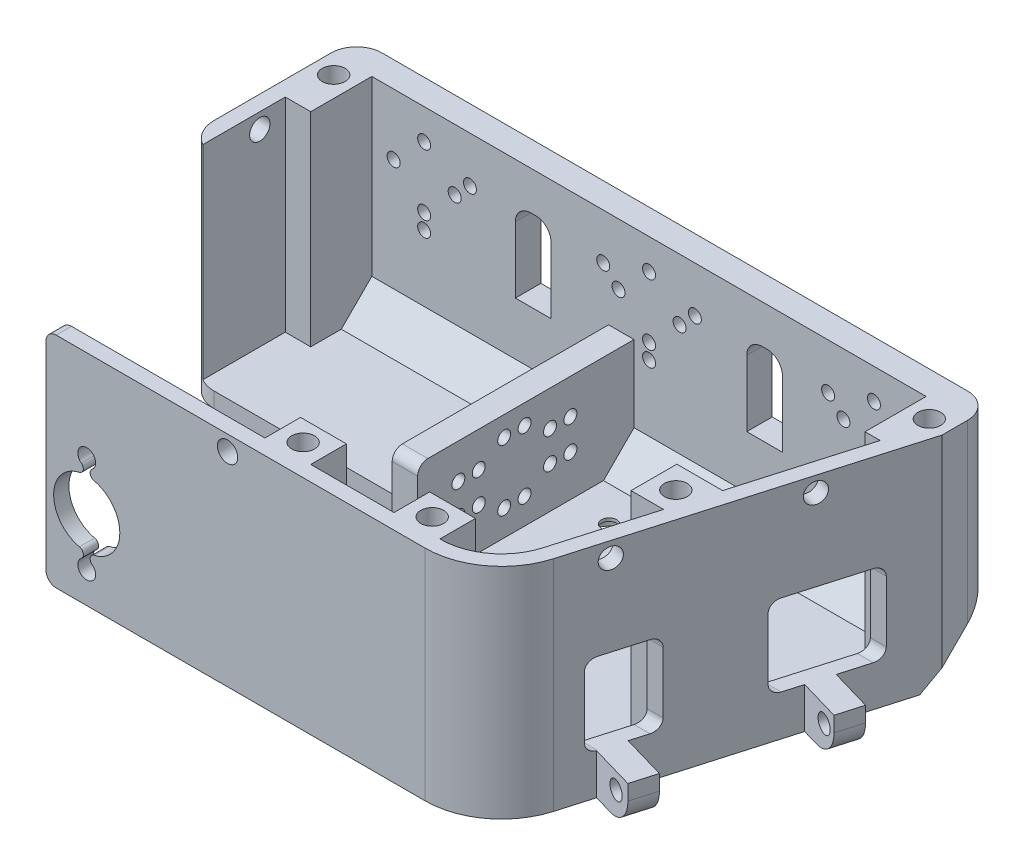
from build123d import *

# Parameters (mm, degrees)
BOSS_EXTRUDE1_DEPTH = 43
FILLET1_R           = 6
SHELL2_START        = 3
SHELL2_DEPTH        = 40
BOSS_EXTRUDE9_REACH = 156.512
SKETCH24_W          = 117.5
SKETCH24_H          = 0.5
CUT_EXTRUDE1_DEPTH  = 40
BOSS_EXTRUDE2_REACH = 156.512
SKETCH3_W           = 5
SKETCH3_H           = 12
SKETCH3_W_2         = 3.623
SKETCH3_W_3         = 9
SKETCH3_H_2         = 7
CHAMFER1_SIZE       = 6
SKETCH5_W           = 5
SKETCH5_H           = 42.5
BOSS_EXTRUDE3_DEPTH = 21
SKETCH11_W          = 3
SKETCH11_H          = 43.022072104
BOSS_EXTRUDE7_DEPTH = 34
BOSS_EXTRUDE8_DEPTH = 8
FILLET2_R           = 5
CUT_EXTRUDE3_START  = 5
CUT_EXTRUDE3_DEPTH  = 113.120726199
CUT_EXTRUDE4_DEPTH  = 158.314375808
SKETCH15_R          = 1.275
CUT_EXTRUDE5_DEPTH  = 5
CUT_EXTRUDE6_REACH  = 153.157
SKETCH16_R          = 2
CUT_EXTRUDE7_REACH  = 133.172
SKETCH17_R          = 1.75
CUT_EXTRUDE8_REACH  = 159.314
SKETCH19_R          = 2
CUT_EXTRUDE9_REACH  = 119.121
SKETCH20_R          = 1.275
SKETCH22_R          = 2.25
CUT_EXTRUDE11_DEPTH = 12
SKETCH22_5_R        = 2.25
CUT_EXTRUDE12_DEPTH = 40
SKETCH22_6_R        = 2.25
CUT_EXTRUDE13_DEPTH = 32
CUT_EXTRUDE14_REACH = 159.314
SKETCH23_R          = 2
EXTRUDE_1_DEPTH     = 4.2
CUT_EXTRUDE_4_REACH = 158.521
SKETCH_7_R          = 1.5
SKETCH_9_R          = 3.75
CUT_EXTRUDE_5_DEPTH = 2.4
CUT_EXTRUDE_2_REACH = 159.314
FILLET_1_R          = 2


# Read off the part's stored shape, not the designer's step: Shell2
with BuildPart() as part:
    # Sketch1 → Boss-Extrude1 (new body)
    with BuildSketch(Plane(origin=(0, 0, 0), x_dir=(1, 0, 0), z_dir=(0, 1, 0))):
        with BuildLine():
            Line((53, 0), (93.476194793, 0))
            ThreePointArc((93.476194793, 0), (102.489207324, 3.009896917), (107.884999865, 10.831616497))
            Line((107.884999865, 10.831616497), (125, 70))
            Line((125, 70), (125, 75))
            ThreePointArc((125, 75), (123.535533906, 78.535533906), (120, 80))
            Line((120, 80), (5, 80))
            ThreePointArc((5, 80), (1.464466094, 78.535533906), (0, 75))
            Line((0, 75), (0, 46))
            Line((0, 46), (53, 46))
            Line((53, 46), (53, 0))
        make_face()
    extrude(amount=BOSS_EXTRUDE1_DEPTH)

    # Fillet1
    fillet1_edges = [part.edges().sort_by_distance(p)[0] for p in [
        (0, 21.5, -46),
    ]]
    fillet(fillet1_edges, radius=FILLET1_R)

    # Shell2 outline → Shell2 (cut)
    with BuildSketch(Plane(origin=(0, 0, 0), x_dir=(1, 0, 0), z_dir=(0, 1, 0)).offset(SHELL2_START)):
        with BuildLine():
            Line((56, 49), (56, 3))
            Line((56, 3), (93.476194793, 3))
            ThreePointArc((93.476194793, 3), (100.686544265, 5.407897312), (105.003142046, 11.665220426))
            Line((105.003142046, 11.665220426), (120.5, 65.239513577))
            Line((120.5, 65.239513577), (120.5, 75))
            ThreePointArc((120.5, 75), (120.353553391, 75.353553391), (120, 75.5))
            Line((120, 75.5), (3, 75.5))
            Line((3, 75.5), (3, 52))
            ThreePointArc((3, 52), (3.878679656, 49.878679656), (6, 49))
            Line((6, 49), (56, 49))
        make_face()
    extrude(amount=SHELL2_DEPTH, mode=Mode.SUBTRACT)

    # Sketch24 → Boss-Extrude9 (add, up to next)
    with BuildSketch(Plane(origin=(0, 43, 0), x_dir=(1, 0, 0), z_dir=(0, 1, 0)), mode=Mode.PRIVATE) as boss_extrude9_sk1:
        with Locations((61.75, 75.25)):
            Rectangle(SKETCH24_W, SKETCH24_H)
    boss_extrude9_tool1 = extrude(boss_extrude9_sk1.sketch, amount=-BOSS_EXTRUDE9_REACH, mode=Mode.PRIVATE) - part.part
    add(boss_extrude9_tool1.solids().sort_by_distance((61.75, 43, -75.25))[0])

    # Sketch2 → Cut-Extrude1 (cut)
    with BuildSketch(Plane(origin=(0, 43, 0), x_dir=(1, 0, 0), z_dir=(0, 1, 0))):
        Polygon((56, 3), (-4, 3), (-4, 42.5), (3, 42.5), (3, 55), (56, 55), align=None)
    extrude(amount=-CUT_EXTRUDE1_DEPTH, mode=Mode.SUBTRACT)

    # Sketch3 → Boss-Extrude2 (add, up to next)
    with BuildSketch(Plane(origin=(0, 43, 0), x_dir=(1, 0, 0), z_dir=(0, 1, 0)), mode=Mode.PRIVATE) as boss_extrude2_sk1:
        Polygon((112.909978914, 39), (103.90997, 39), (103.90997, 30), (110.306645984, 30), align=None)
    boss_extrude2_tool1 = extrude(boss_extrude2_sk1.sketch, amount=-BOSS_EXTRUDE2_REACH, mode=Mode.PRIVATE) - part.part
    # Sketch3 → Boss-Extrude2 (add, up to next)
    with BuildSketch(Plane(origin=(0, 43, 0), x_dir=(1, 0, 0), z_dir=(0, 1, 0)), mode=Mode.PRIVATE) as boss_extrude2_sk2:
        with Locations((5.5, 69)):
            Rectangle(SKETCH3_W, SKETCH3_H)
    boss_extrude2_tool2 = extrude(boss_extrude2_sk2.sketch, amount=-BOSS_EXTRUDE2_REACH, mode=Mode.PRIVATE) - part.part
    # Sketch3 → Boss-Extrude2 (add, up to next)
    with BuildSketch(Plane(origin=(0, 43, 0), x_dir=(1, 0, 0), z_dir=(0, 1, 0)), mode=Mode.PRIVATE) as boss_extrude2_sk3:
        with Locations((118.6885, 69)):
            Rectangle(SKETCH3_W_2, SKETCH3_H)
    boss_extrude2_tool3 = extrude(boss_extrude2_sk3.sketch, amount=-BOSS_EXTRUDE2_REACH, mode=Mode.PRIVATE) - part.part
    # Sketch3 → Boss-Extrude2 (add, up to next)
    with BuildSketch(Plane(origin=(0, 43, 0), x_dir=(1, 0, 0), z_dir=(0, 1, 0)), mode=Mode.PRIVATE) as boss_extrude2_sk4:
        with Locations((88.85855, 6.5)):
            Rectangle(SKETCH3_W_3, SKETCH3_H_2)
    boss_extrude2_tool4 = extrude(boss_extrude2_sk4.sketch, amount=-BOSS_EXTRUDE2_REACH, mode=Mode.PRIVATE) - part.part
    # Sketch3 → Boss-Extrude2 (add, up to next)
    with BuildSketch(Plane(origin=(0, 43, 0), x_dir=(1, 0, 0), z_dir=(0, 1, 0)), mode=Mode.PRIVATE) as boss_extrude2_sk5:
        with Locations((63.5, 6.5)):
            Rectangle(SKETCH3_W_3, SKETCH3_H_2)
    boss_extrude2_tool5 = extrude(boss_extrude2_sk5.sketch, amount=-BOSS_EXTRUDE2_REACH, mode=Mode.PRIVATE) - part.part
    add(boss_extrude2_tool1.solids().sort_by_distance((107.795823, 43, -34.753626))[0])
    add(boss_extrude2_tool2.solids().sort_by_distance((5.5, 43, -69))[0])
    add(boss_extrude2_tool3.solids().sort_by_distance((118.6885, 43, -69))[0])
    add(boss_extrude2_tool4.solids().sort_by_distance((88.85855, 43, -6.5))[0])
    add(boss_extrude2_tool5.solids().sort_by_distance((63.5, 43, -6.5))[0])

    # Chamfer1
    chamfer1_edges = [part.edges().sort_by_distance(p)[0] for p in [
        (62.4385, 3, -75),
    ]]
    chamfer(chamfer1_edges, length=CHAMFER1_SIZE)

    # Sketch5 → Boss-Extrude3 (add)
    with BuildSketch(Plane(origin=(0, 3, 0), x_dir=(1, 0, 0), z_dir=(0, 1, 0))):
        with Locations((56.99999, 53.75)):
            Rectangle(SKETCH5_W, SKETCH5_H)
    extrude(amount=BOSS_EXTRUDE3_DEPTH)

    # Sketch11 → Boss-Extrude7 (add)
    with BuildSketch(Plane.ZY.offset(-53)):
        with Locations((-1.5, 21.488963948)):
            Rectangle(SKETCH11_W, SKETCH11_H)
    extrude(amount=BOSS_EXTRUDE7_DEPTH)

    # Sketch12 → Boss-Extrude8 (add)
    with BuildSketch(Plane.XZ):
        Polygon((109.776998782, -17.372458834), (111.166338664, -22.1755552), (119.811912121, -19.674743412), (118.422572239, -14.871647047), align=None)
        Polygon((118.946642001, -49.072894844), (120.335981883, -53.87599121), (128.447704673, -51.529600647), (127.058364792, -46.726504282), align=None)
    extrude(amount=-BOSS_EXTRUDE8_DEPTH)

    # Fillet2
    fillet2_edges = [part.edges().sort_by_distance(p)[0] for p in [
        (119.11724218, 0, -17.27319523),
        (127.753034732, 0, -49.128052464),
    ]]
    fillet(fillet2_edges, radius=FILLET2_R)

    # Sketch13 → Cut-Extrude3 (cut, through all)
    with BuildSketch(Plane(origin=(54.49999, 0, 0), x_dir=(0, 0, -1), z_dir=(1, 0, 0)).offset(CUT_EXTRUDE3_START)):
        with BuildLine():
            Line((17.5014, 24), (25.5014, 24))
            ThreePointArc((25.5014, 24), (26.915613562, 23.414213562), (27.5014, 22))
            Line((27.5014, 22), (27.5014, 10))
            ThreePointArc((27.5014, 10), (26.915613562, 8.585786438), (25.5014, 8))
            Line((25.5014, 8), (17.5014, 8))
            ThreePointArc((17.5014, 8), (16.087186438, 8.585786438), (15.5014, 10))
            Line((15.5014, 10), (15.5014, 22))
            ThreePointArc((15.5014, 22), (16.087186438, 23.414213562), (17.5014, 24))
        make_face()
        with BuildLine():
            Line((45.5014, 24), (59.5014, 24))
            ThreePointArc((59.5014, 24), (60.915613562, 23.414213562), (61.5014, 22))
            Line((61.5014, 22), (61.5014, 10))
            ThreePointArc((61.5014, 10), (60.915613562, 8.585786438), (59.5014, 8))
            Line((59.5014, 8), (45.5014, 8))
            ThreePointArc((45.5014, 8), (44.087186438, 8.585786438), (43.5014, 10))
            Line((43.5014, 10), (43.5014, 22))
            ThreePointArc((43.5014, 22), (44.087186438, 23.414213562), (45.5014, 24))
        make_face()
    extrude(amount=CUT_EXTRUDE3_DEPTH, mode=Mode.SUBTRACT)

    # Sketch14 → Cut-Extrude4 (cut, through all)
    with BuildSketch(Plane.ZY):
        Polygon((-80, 13.4), (-80, 0), (-66.6, 0), align=None)
    extrude(amount=-CUT_EXTRUDE4_DEPTH, mode=Mode.SUBTRACT)

    # Sketch15 → Cut-Extrude5 (cut)
    with BuildSketch(Plane(origin=(0, 0, -80), x_dir=(-1, 0, 0), z_dir=(0, 0, -1))):
        with Locations((-62.45, 25)):
            Circle(SKETCH15_R)
        with Locations((-62.45, 37)):
            Circle(SKETCH15_R)
        with Locations((-62.45, 22)):
            Circle(SKETCH15_R)
        with Locations((-68.45, 31)):
            Circle(SKETCH15_R)
        with Locations((-71.45, 34)):
            Circle(SKETCH15_R)
        with Locations(Location((-53.45, 34, 0), (0, 0, 180))):
            Circle(SKETCH15_R)
        with Locations(Location((-56.45, 31, 0), (0, 0, 180))):
            Circle(SKETCH15_R)
        with Locations((-18.275, 25)):
            Circle(SKETCH15_R)
        with Locations((-18.275, 37)):
            Circle(SKETCH15_R)
        with Locations((-18.275, 22)):
            Circle(SKETCH15_R)
        with Locations((-24.275, 31)):
            Circle(SKETCH15_R)
        with Locations((-27.275, 34)):
            Circle(SKETCH15_R)
        with Locations(Location((-12.275, 31, 0), (0, 0, 180))):
            Circle(SKETCH15_R)
        with Locations((-106.625, 25)):
            Circle(SKETCH15_R)
        with Locations((-106.625, 37)):
            Circle(SKETCH15_R)
        with Locations((-106.625, 22)):
            Circle(SKETCH15_R)
        with Locations((-112.625, 31)):
            Circle(SKETCH15_R)
        with Locations((-115.625, 34)):
            Circle(SKETCH15_R)
        with Locations(Location((-97.625, 34, 0), (0, 0, 180))):
            Circle(SKETCH15_R)
        with Locations(Location((-100.625, 31, 0), (0, 0, 180))):
            Circle(SKETCH15_R)
        with BuildLine():
            Line((-88.65, 19.4), (-81.65, 19.4))
            Line((-81.65, 19.4), (-81.65, 32.4))
            ThreePointArc((-81.65, 32.4), (-82.528679656, 34.521320344), (-84.65, 35.4))
            Line((-84.65, 35.4), (-85.65, 35.4))
            ThreePointArc((-85.65, 35.4), (-87.771320344, 34.521320344), (-88.65, 32.4))
            Line((-88.65, 32.4), (-88.65, 19.4))
        make_face()
        with BuildLine():
            Line((-43.2, 19.4), (-36.2, 19.4))
            Line((-36.2, 19.4), (-36.2, 32.4))
            ThreePointArc((-36.2, 32.4), (-37.078679656, 34.521320344), (-39.2, 35.4))
            Line((-39.2, 35.4), (-40.2, 35.4))
            ThreePointArc((-40.2, 35.4), (-42.321320344, 34.521320344), (-43.2, 32.4))
            Line((-43.2, 32.4), (-43.2, 19.4))
        make_face()
    extrude(amount=-CUT_EXTRUDE5_DEPTH, mode=Mode.SUBTRACT)

    # Sketch16 → Cut-Extrude6 (cut, up to next)
    with BuildSketch(Plane(origin=(96.663900125, 0, 27.96092382), x_dir=(0.2778679763428232, 0, -0.9606192730333617), z_dir=(0.9606192730333617, 0, 0.2778679763428232)), mode=Mode.PRIVATE) as cut_extrude6_sk1:
        with Locations((49.441846155, 40)):
            Circle(SKETCH16_R)
    cut_extrude6_tool1 = extrude(cut_extrude6_sk1.sketch, amount=-CUT_EXTRUDE6_REACH, mode=Mode.PRIVATE) & part.part
    # Sketch16 → Cut-Extrude6 (cut, up to next)
    with BuildSketch(Plane(origin=(96.663900125, 0, 27.96092382), x_dir=(0.2778679763428232, 0, -0.9606192730333617), z_dir=(0.9606192730333617, 0, 0.2778679763428232)), mode=Mode.PRIVATE) as cut_extrude6_sk2:
        with Locations((81.976846155, 40)):
            Circle(SKETCH16_R)
    cut_extrude6_tool2 = extrude(cut_extrude6_sk2.sketch, amount=-CUT_EXTRUDE6_REACH, mode=Mode.PRIVATE) & part.part
    add(cut_extrude6_tool1.solids().sort_by_distance((110.402206, 40, -19.533866))[0], mode=Mode.SUBTRACT)
    add(cut_extrude6_tool2.solids().sort_by_distance((119.44264, 40, -50.787615))[0], mode=Mode.SUBTRACT)

    # Cut-Extrude7: up to this face of the body (flat: up to its plane)
    cut_extrude7_end = Plane(part.part.faces().sort_by_distance((124.134499785, 4.248730015, -52.777234905))[0])
    # Sketch17 → Cut-Extrude7 (cut, up to the picked face)
    with BuildSketch(Plane(origin=(13.113098657, 0, -45.333382654), x_dir=(0.9606192730333615, 0, 0.2778679763428241), z_dir=(-0.27786797634282406, 0, 0.9606192730333614)), mode=Mode.PRIVATE) as cut_extrude7_sk1:
        with Locations((106.226650785, 4.8)):
            Circle(SKETCH17_R)
    cut_extrude7_tool1 = split(extrude(cut_extrude7_sk1.sketch, amount=-CUT_EXTRUDE7_REACH, mode=Mode.PRIVATE), bisect_by=cut_extrude7_end, keep=Keep.BOTH, mode=Mode.PRIVATE)
    add(cut_extrude7_tool1.solids().sort_by(Axis((115.156467, 4.8, -15.816398), (0.27786797634282406, 0, -0.9606192730333614)))[0], mode=Mode.SUBTRACT)

    # Sketch19 → Cut-Extrude8 (cut, up to next)
    with BuildSketch(Plane.XY, mode=Mode.PRIVATE) as cut_extrude8_sk1:
        with Locations((54.66050872, 40)):
            Circle(SKETCH19_R)
    cut_extrude8_tool1 = extrude(cut_extrude8_sk1.sketch, amount=-CUT_EXTRUDE8_REACH, mode=Mode.PRIVATE) & part.part
    add(cut_extrude8_tool1.solids().sort_by_distance((54.660509, 40, 0))[0], mode=Mode.SUBTRACT)

    # Sketch20 → Cut-Extrude9 (cut, up to next)
    with BuildSketch(Plane.ZY.offset(-54.49999), mode=Mode.PRIVATE) as cut_extrude9_sk1:
        with Locations((-49.5, 20.1)):
            Circle(SKETCH20_R)
    cut_extrude9_tool1 = extrude(cut_extrude9_sk1.sketch, amount=-CUT_EXTRUDE9_REACH, mode=Mode.PRIVATE) & part.part
    # Sketch20 → Cut-Extrude9 (cut, up to next)
    with BuildSketch(Plane.ZY.offset(-54.49999), mode=Mode.PRIVATE) as cut_extrude9_sk2:
        with Locations((-40.5, 17.1)):
            Circle(SKETCH20_R)
    cut_extrude9_tool2 = extrude(cut_extrude9_sk2.sketch, amount=-CUT_EXTRUDE9_REACH, mode=Mode.PRIVATE) & part.part
    # Sketch20 → Cut-Extrude9 (cut, up to next)
    with BuildSketch(Plane.ZY.offset(-54.49999), mode=Mode.PRIVATE) as cut_extrude9_sk3:
        with Locations((-40.5, 11.1)):
            Circle(SKETCH20_R)
    cut_extrude9_tool3 = extrude(cut_extrude9_sk3.sketch, amount=-CUT_EXTRUDE9_REACH, mode=Mode.PRIVATE) & part.part
    # Sketch20 → Cut-Extrude9 (cut, up to next)
    with BuildSketch(Plane.ZY.offset(-54.49999), mode=Mode.PRIVATE) as cut_extrude9_sk4:
        with Locations((-49.5, 8.1)):
            Circle(SKETCH20_R)
    cut_extrude9_tool4 = extrude(cut_extrude9_sk4.sketch, amount=-CUT_EXTRUDE9_REACH, mode=Mode.PRIVATE) & part.part
    # Sketch20 → Cut-Extrude9 (cut, up to next)
    with BuildSketch(Plane.ZY.offset(-54.49999), mode=Mode.PRIVATE) as cut_extrude9_sk5:
        with Locations((-58.5, 17.1)):
            Circle(SKETCH20_R)
    cut_extrude9_tool5 = extrude(cut_extrude9_sk5.sketch, amount=-CUT_EXTRUDE9_REACH, mode=Mode.PRIVATE) & part.part
    # Sketch20 → Cut-Extrude9 (cut, up to next)
    with BuildSketch(Plane.ZY.offset(-54.49999), mode=Mode.PRIVATE) as cut_extrude9_sk6:
        with Locations((-58.5, 11.1)):
            Circle(SKETCH20_R)
    cut_extrude9_tool6 = extrude(cut_extrude9_sk6.sketch, amount=-CUT_EXTRUDE9_REACH, mode=Mode.PRIVATE) & part.part
    # Sketch20 → Cut-Extrude9 (cut, up to next)
    with BuildSketch(Plane.ZY.offset(-54.49999), mode=Mode.PRIVATE) as cut_extrude9_sk7:
        with Locations((-53.5, 8.1)):
            Circle(SKETCH20_R)
    cut_extrude9_tool7 = extrude(cut_extrude9_sk7.sketch, amount=-CUT_EXTRUDE9_REACH, mode=Mode.PRIVATE) & part.part
    # Sketch20 → Cut-Extrude9 (cut, up to next)
    with BuildSketch(Plane.ZY.offset(-54.49999), mode=Mode.PRIVATE) as cut_extrude9_sk8:
        with Locations((-44.5, 11.1)):
            Circle(SKETCH20_R)
    cut_extrude9_tool8 = extrude(cut_extrude9_sk8.sketch, amount=-CUT_EXTRUDE9_REACH, mode=Mode.PRIVATE) & part.part
    # Sketch20 → Cut-Extrude9 (cut, up to next)
    with BuildSketch(Plane.ZY.offset(-54.49999), mode=Mode.PRIVATE) as cut_extrude9_sk9:
        with Locations((-44.5, 17.1)):
            Circle(SKETCH20_R)
    cut_extrude9_tool9 = extrude(cut_extrude9_sk9.sketch, amount=-CUT_EXTRUDE9_REACH, mode=Mode.PRIVATE) & part.part
    # Sketch20 → Cut-Extrude9 (cut, up to next)
    with BuildSketch(Plane.ZY.offset(-54.49999), mode=Mode.PRIVATE) as cut_extrude9_sk10:
        with Locations((-53.5, 20.1)):
            Circle(SKETCH20_R)
    cut_extrude9_tool10 = extrude(cut_extrude9_sk10.sketch, amount=-CUT_EXTRUDE9_REACH, mode=Mode.PRIVATE) & part.part
    # Sketch20 → Cut-Extrude9 (cut, up to next)
    with BuildSketch(Plane.ZY.offset(-54.49999), mode=Mode.PRIVATE) as cut_extrude9_sk11:
        with Locations((-62.5, 17.1)):
            Circle(SKETCH20_R)
    cut_extrude9_tool11 = extrude(cut_extrude9_sk11.sketch, amount=-CUT_EXTRUDE9_REACH, mode=Mode.PRIVATE) & part.part
    # Sketch20 → Cut-Extrude9 (cut, up to next)
    with BuildSketch(Plane.ZY.offset(-54.49999), mode=Mode.PRIVATE) as cut_extrude9_sk12:
        with Locations((-62.5, 11.1)):
            Circle(SKETCH20_R)
    cut_extrude9_tool12 = extrude(cut_extrude9_sk12.sketch, amount=-CUT_EXTRUDE9_REACH, mode=Mode.PRIVATE) & part.part
    add(cut_extrude9_tool1.solids().sort_by_distance((54.49999, 20.1, -49.5))[0], mode=Mode.SUBTRACT)
    add(cut_extrude9_tool2.solids().sort_by_distance((54.49999, 17.1, -40.5))[0], mode=Mode.SUBTRACT)
    add(cut_extrude9_tool3.solids().sort_by_distance((54.49999, 11.1, -40.5))[0], mode=Mode.SUBTRACT)
    add(cut_extrude9_tool4.solids().sort_by_distance((54.49999, 8.1, -49.5))[0], mode=Mode.SUBTRACT)
    add(cut_extrude9_tool5.solids().sort_by_distance((54.49999, 17.1, -58.5))[0], mode=Mode.SUBTRACT)
    add(cut_extrude9_tool6.solids().sort_by_distance((54.49999, 11.1, -58.5))[0], mode=Mode.SUBTRACT)
    add(cut_extrude9_tool7.solids().sort_by_distance((54.49999, 8.1, -53.5))[0], mode=Mode.SUBTRACT)
    add(cut_extrude9_tool8.solids().sort_by_distance((54.49999, 11.1, -44.5))[0], mode=Mode.SUBTRACT)
    add(cut_extrude9_tool9.solids().sort_by_distance((54.49999, 17.1, -44.5))[0], mode=Mode.SUBTRACT)
    add(cut_extrude9_tool10.solids().sort_by_distance((54.49999, 20.1, -53.5))[0], mode=Mode.SUBTRACT)
    add(cut_extrude9_tool11.solids().sort_by_distance((54.49999, 17.1, -62.5))[0], mode=Mode.SUBTRACT)
    add(cut_extrude9_tool12.solids().sort_by_distance((54.49999, 11.1, -62.5))[0], mode=Mode.SUBTRACT)

    # Sketch22 → Cut-Extrude11 (cut)
    with BuildSketch(Plane(origin=(0, 43, 0), x_dir=(1, 0, 0), z_dir=(0, 1, 0))):
        with Locations(Location((121, 71.5, 0), (0, 0, 270))):
            Circle(SKETCH22_R)
        with Locations(Location((4, 71.5, 0), (0, 0, 270))):
            Circle(SKETCH22_R)
    extrude(amount=-CUT_EXTRUDE11_DEPTH, mode=Mode.SUBTRACT)

    # Sketch22<5> → Cut-Extrude12 (cut)
    with BuildSketch(Plane(origin=(0, 43, 0), x_dir=(1, 0, 0), z_dir=(0, 1, 0))):
        with Locations(Location((108.20997, 34.5, 0), (0, 0, 270))):
            Circle(SKETCH22_5_R)
    extrude(amount=-CUT_EXTRUDE12_DEPTH, mode=Mode.SUBTRACT)

    # Sketch22<6> → Cut-Extrude13 (cut)
    with BuildSketch(Plane(origin=(0, 43, 0), x_dir=(1, 0, 0), z_dir=(0, 1, 0))):
        with Locations(Location((63.5, 6, 0), (0, 0, 270))):
            Circle(SKETCH22_6_R)
        with Locations(Location((88.85855, 6, 0), (0, 0, 270))):
            Circle(SKETCH22_6_R)
    extrude(amount=-CUT_EXTRUDE13_DEPTH, mode=Mode.SUBTRACT)

    # Sketch23 → Cut-Extrude14 (cut, up to next)
    with BuildSketch(Plane.ZY, mode=Mode.PRIVATE) as cut_extrude14_sk1:
        with Locations((-58, 40)):
            Circle(SKETCH23_R)
    cut_extrude14_tool1 = extrude(cut_extrude14_sk1.sketch, amount=-CUT_EXTRUDE14_REACH, mode=Mode.PRIVATE) & part.part
    add(cut_extrude14_tool1.solids().sort_by_distance((0, 40, -58))[0], mode=Mode.SUBTRACT)

    # 草图2 → 凸台-拉伸1 (add)
    with BuildSketch(Plane.XZ.offset(0.022072104)):
        Polygon((53, -7), (49, -3), (53, -3), align=None)
    extrude(amount=-EXTRUDE_1_DEPTH)

    # 草图7 → 切除-拉伸4 (cut, up to next)
    with BuildSketch(Plane(origin=(0, 3, 0), x_dir=(1, 0, 0), z_dir=(0, 1, 0)), mode=Mode.PRIVATE) as cut_extrude_4_sk1:
        with Locations(Location((67.44999, 62.15, 0), (0, 0, 270))):
            Circle(SKETCH_7_R)
    cut_extrude_4_tool1 = extrude(cut_extrude_4_sk1.sketch, amount=-CUT_EXTRUDE_4_REACH, mode=Mode.PRIVATE) & part.part
    # 草图7 → 切除-拉伸4 (cut, up to next)
    with BuildSketch(Plane(origin=(0, 3, 0), x_dir=(1, 0, 0), z_dir=(0, 1, 0)), mode=Mode.PRIVATE) as cut_extrude_4_sk2:
        with Locations(Location((96.14999, 62.15, 0), (0, 0, 270))):
            Circle(SKETCH_7_R)
    cut_extrude_4_tool2 = extrude(cut_extrude_4_sk2.sketch, amount=-CUT_EXTRUDE_4_REACH, mode=Mode.PRIVATE) & part.part
    # 草图7 → 切除-拉伸4 (cut, up to next)
    with BuildSketch(Plane(origin=(0, 3, 0), x_dir=(1, 0, 0), z_dir=(0, 1, 0)), mode=Mode.PRIVATE) as cut_extrude_4_sk3:
        with Locations(Location((96.14999, 13.65, 0), (0, 0, 270))):
            Circle(SKETCH_7_R)
    cut_extrude_4_tool3 = extrude(cut_extrude_4_sk3.sketch, amount=-CUT_EXTRUDE_4_REACH, mode=Mode.PRIVATE) & part.part
    # 草图7 → 切除-拉伸4 (cut, up to next)
    with BuildSketch(Plane(origin=(0, 3, 0), x_dir=(1, 0, 0), z_dir=(0, 1, 0)), mode=Mode.PRIVATE) as cut_extrude_4_sk4:
        with Locations(Location((67.44999, 13.65, 0), (0, 0, 270))):
            Circle(SKETCH_7_R)
    cut_extrude_4_tool4 = extrude(cut_extrude_4_sk4.sketch, amount=-CUT_EXTRUDE_4_REACH, mode=Mode.PRIVATE) & part.part
    add(cut_extrude_4_tool1.solids().sort_by_distance((67.44999, 3, -62.15))[0], mode=Mode.SUBTRACT)
    add(cut_extrude_4_tool2.solids().sort_by_distance((96.14999, 3, -62.15))[0], mode=Mode.SUBTRACT)
    add(cut_extrude_4_tool3.solids().sort_by_distance((96.14999, 3, -13.65))[0], mode=Mode.SUBTRACT)
    add(cut_extrude_4_tool4.solids().sort_by_distance((67.44999, 3, -13.65))[0], mode=Mode.SUBTRACT)

    # 草图9 → 切除-拉伸5 (cut)
    with BuildSketch(Plane.XZ):
        with Locations(Location((67.44999, -13.65, 0), (0, 0, 270))):
            Circle(SKETCH_9_R)
        with Locations(Location((96.14999, -13.65, 0), (0, 0, 90))):
            Circle(SKETCH_9_R)
        with Locations(Location((96.14999, -62.15, 0), (0, 0, 270))):
            Circle(SKETCH_9_R)
        with Locations(Location((67.44999, -62.15, 0), (0, 0, 90))):
            Circle(SKETCH_9_R)
    extrude(amount=-CUT_EXTRUDE_5_DEPTH, mode=Mode.SUBTRACT)

    # 草图5 → 切除-拉伸2 (cut, up to next)
    with BuildSketch(Plane.XY, mode=Mode.PRIVATE) as cut_extrude_2_sk1:
        with BuildLine():
            ThreePointArc((25.555658407, 21.9375), (20.49999, 15.6), (25.555658407, 9.2625))
            ThreePointArc((25.555658407, 9.2625), (26.310752701, 8.499364022), (25.939466802, 7.492045455))
            ThreePointArc((25.939466802, 7.492045455), (26.99999, 4.35), (28.060513198, 7.492045455))
            ThreePointArc((28.060513198, 7.492045455), (27.689227299, 8.499364022), (28.444321593, 9.2625))
            ThreePointArc((28.444321593, 9.2625), (33.49999, 15.6), (28.444321593, 21.9375))
            ThreePointArc((28.444321593, 21.9375), (27.689227299, 22.700635978), (28.060513198, 23.707954545))
            ThreePointArc((28.060513198, 23.707954545), (26.99999, 26.85), (25.939466802, 23.707954545))
            ThreePointArc((25.939466802, 23.707954545), (26.310752701, 22.700635978), (25.555658407, 21.9375))
        make_face()
    cut_extrude_2_tool1 = extrude(cut_extrude_2_sk1.sketch, amount=-CUT_EXTRUDE_2_REACH, mode=Mode.PRIVATE) & part.part
    add(cut_extrude_2_tool1.solids().sort_by_distance((26.99999, 15.6, 0))[0], mode=Mode.SUBTRACT)

    # 圆角1
    fillet_1_edges = [part.edges().sort_by_distance(p)[0] for p in [
        (56.99999, 24, -32.5),
        (19, -0.022072104, -1.5),
        (19, 43, -1.5),
    ]]
    fillet(fillet_1_edges, radius=FILLET_1_R)


solid = part.part
